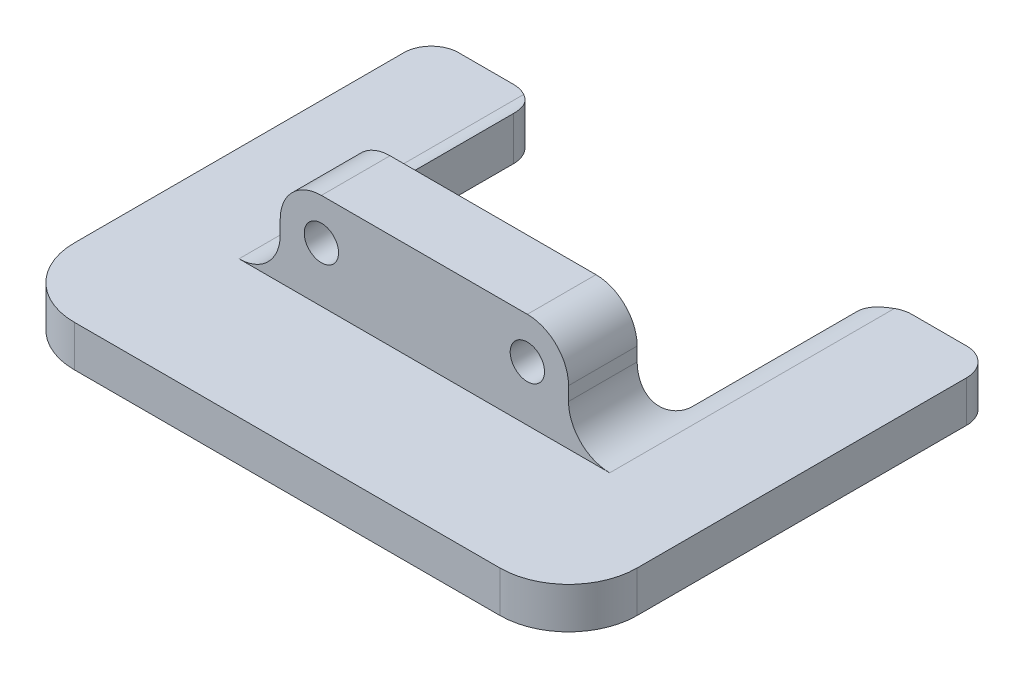
from build123d import *

# Parameters (mm, degrees)
SKETCH_1_R      = 1.25
EXTRUDE_1_DEPTH = 5
SKETCH_2_W      = 41
SKETCH_2_H      = 15
EXTRUDE_2_DEPTH = 3
SKETCH_4_W      = 8
SKETCH_4_H      = 16
EXTRUDE_3_DEPTH = 3
FILLET_1_R      = 3
FILLET_2_R      = 5
FILLET_3_R      = 2


with BuildPart() as part:
    # ｽｹｯﾁ1 → ﾎﾞｽ - 押し出し1 (new body)
    with BuildSketch(Plane.XY):
        with BuildLine():
            Line((-3, -4), (18, -4))
            Line((18, -4), (18, 0))
            ThreePointArc((18, 0), (17.121320344, 2.121320344), (15, 3))
            Line((15, 3), (0, 3))
            ThreePointArc((0, 3), (-2.121320344, 2.121320344), (-3, 0))
            Line((-3, 0), (-3, -4))
        make_face()
        Circle(SKETCH_1_R, mode=Mode.SUBTRACT)
        with Locations((15, 0)):
            Circle(SKETCH_1_R, mode=Mode.SUBTRACT)
    extrude(amount=EXTRUDE_1_DEPTH)

    # ｽｹｯﾁ2 → ﾎﾞｽ - 押し出し2 (add)
    with BuildSketch(Plane.XZ.offset(4)):
        with Locations((7.5, 7.5)):
            Rectangle(SKETCH_2_W, SKETCH_2_H)
    extrude(amount=EXTRUDE_2_DEPTH)

    # ｽｹｯﾁ4 → ﾎﾞｽ - 押し出し3 (add)
    with BuildSketch(Plane(origin=(0, -4, 0), x_dir=(1, 0, 0), z_dir=(0, 1, 0))):
        with Locations((-9, 8)):
            Rectangle(SKETCH_4_W, SKETCH_4_H)
        with Locations((24, 8)):
            Rectangle(SKETCH_4_W, SKETCH_4_H)
    extrude(amount=-EXTRUDE_3_DEPTH)

    # ﾌｨﾚｯﾄ1
    fillet_1_edges = [part.edges().sort_by_distance(p)[0] for p in [
        (-3, -4, 2.5),
        (18, -4, 2.5),
    ]]
    fillet(fillet_1_edges, radius=FILLET_1_R)

    # ﾌｨﾚｯﾄ2
    fillet_2_edges = [part.edges().sort_by_distance(p)[0] for p in [
        (-13, -5.5, 15),
        (28, -5.5, 15),
    ]]
    fillet(fillet_2_edges, radius=FILLET_2_R)

    # ﾌｨﾚｯﾄ3
    fillet_3_edges = [part.edges().sort_by_distance(p)[0] for p in [
        (28, -5.5, -16),
        (20, -5.414213562, -16),
        (20, -5.414213562, 0),
        (-5, -5.414213562, 0),
        (-5, -5.414213562, -16),
        (-13, -5.5, -16),
    ]]
    fillet(fillet_3_edges, radius=FILLET_3_R - 0.0001)  # a hair under: the kernel refuses the full size


solid = part.part
